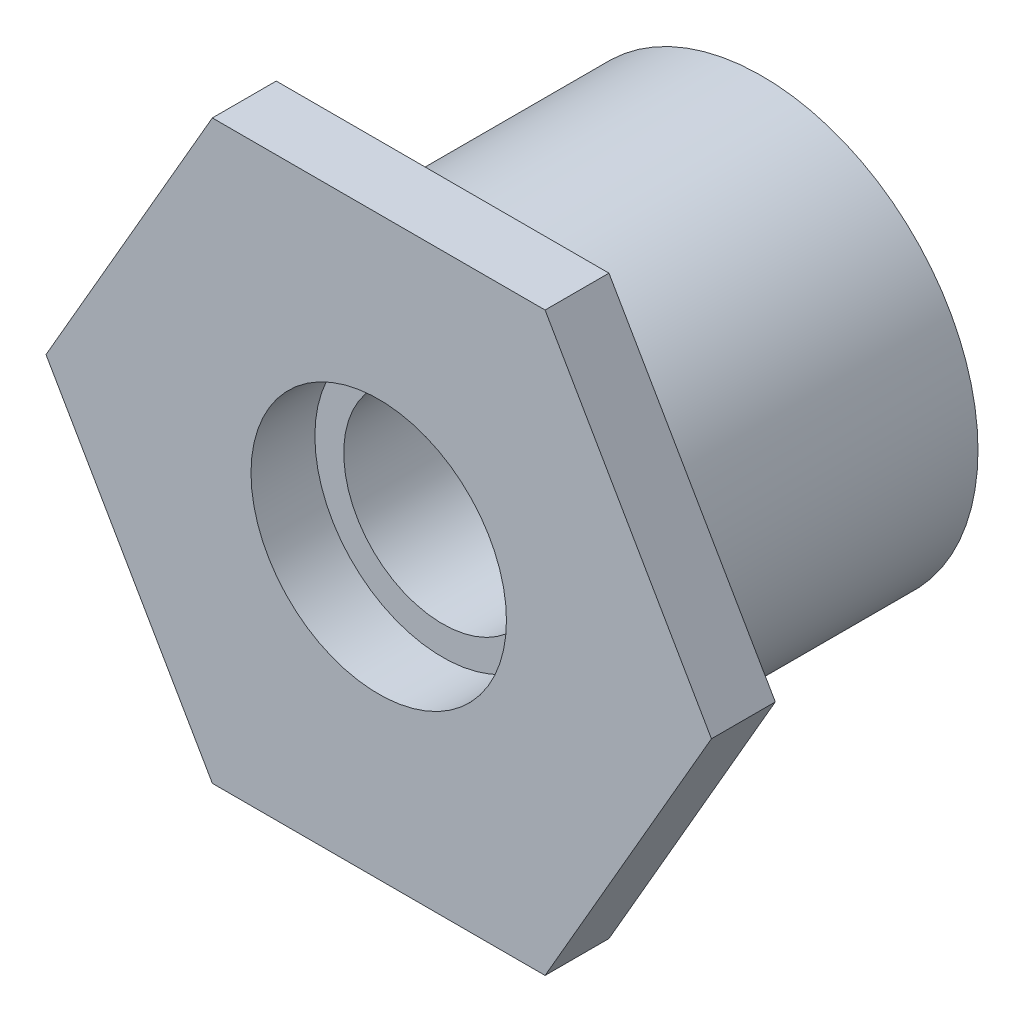
from build123d import *

# Parameters (mm, degrees)
SKETCH1_R           = 21.4884
SKETCH1_R_2         = 17.5768
BOSS_EXTRUDE1_DEPTH = 6.35
SKETCH1_3_R         = 21.4884
SKETCH1_3_R_2       = 17.5768
BOSS_EXTRUDE2_DEPTH = 31.75
SKETCH1_4_R         = 21.4884
BOSS_EXTRUDE3_DEPTH = 6.35
SKETCH1_5_R         = 12.7
SKETCH1_5_R_2       = 9.8298
BOSS_EXTRUDE4_DEPTH = 19.05
SKETCH1_6_R         = 17.5768
SKETCH1_6_R_2       = 12.7
BOSS_EXTRUDE5_DEPTH = 6.35


with BuildPart() as part:
    # Sketch1 → Boss-Extrude1 (new body)
    with BuildSketch(Plane.XY):
        Circle(SKETCH1_R)
        Circle(SKETCH1_R_2, mode=Mode.SUBTRACT)
    extrude(amount=BOSS_EXTRUDE1_DEPTH)



with BuildPart() as body_2:
    # Sketch1<3> → Boss-Extrude2 (new body)
    with BuildSketch(Plane.XY):
        Circle(SKETCH1_3_R)
        Circle(SKETCH1_3_R_2, mode=Mode.SUBTRACT)
    extrude(amount=-BOSS_EXTRUDE2_DEPTH)


with BuildPart() as part_1:
    add(part.part)

    add(body_2.part)  # Boss-Extrude3 merges body 2
    # Sketch1<4> → Boss-Extrude3 (add)
    with BuildSketch(Plane.XY):
        Polygon((16.541778033, -28.6512), (33.083556065, 0), (16.541778033, 28.6512), (-16.541778033, 28.6512), (-33.083556065, 0), (-16.541778033, -28.6512), align=None)
        Circle(SKETCH1_4_R, mode=Mode.SUBTRACT)
    extrude(amount=BOSS_EXTRUDE3_DEPTH)

    # Sketch1<6> → Boss-Extrude5 (add)
    with BuildSketch(Plane.XY):
        Circle(SKETCH1_6_R)
        Circle(SKETCH1_6_R_2, mode=Mode.SUBTRACT)
    extrude(amount=BOSS_EXTRUDE5_DEPTH)


with BuildPart() as body_2_2:
    # Sketch1<5> → Boss-Extrude4 (new body)
    with BuildSketch(Plane.XY):
        Circle(SKETCH1_5_R)
        Circle(SKETCH1_5_R_2, mode=Mode.SUBTRACT)
    extrude(amount=-BOSS_EXTRUDE4_DEPTH)


solid = Compound([part_1.part, body_2_2.part])
